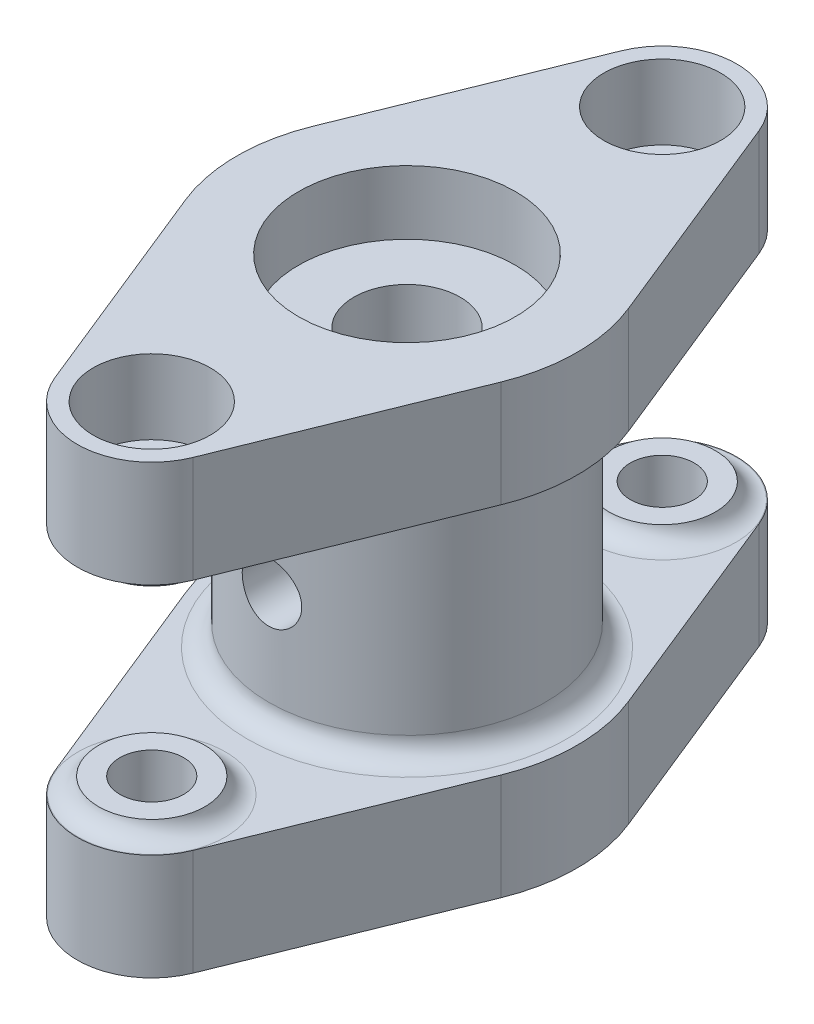
from build123d import *

# Parameters (mm, degrees)
SKETCH1_R           = 1.5
BOSS_EXTRUDE1_DEPTH = 5
SKETCH2_R           = 6.5
BOSS_EXTRUDE2_DEPTH = 11
SKETCH3_R           = 1.5
BOSS_EXTRUDE3_DEPTH = 5
SKETCH4_R           = 1.4
CUT_EXTRUDE1_DEPTH  = 28.299267389
FILLET1_R           = 1
CUT_EXTRUDE2_DEPTH  = 3
SKETCH8_R           = 2.5
SKETCH8_R_2         = 1.5
BOSS_EXTRUDE5_DEPTH = 0.75
FILLET4_R           = 1
BOSS_EXTRUDE6_START = 0.75
SKETCH9_R           = 2.5
SKETCH9_R_2         = 1.5
BOSS_EXTRUDE6_DEPTH = 0.75
FILLET5_R           = 1
SKETCH12_R          = 2.75
CUT_EXTRUDE5_DEPTH  = 3.5
SKETCH10_R          = 5.1
CUT_EXTRUDE3_DEPTH  = 3
CUT_EXTRUDE4_START  = -3.5
SKETCH11_R          = 5.1
CUT_EXTRUDE4_DEPTH  = 3.5


with BuildPart() as part:
    # Sketch1 → Boss-Extrude1 (new body)
    with BuildSketch(Plane(origin=(0, 0, 0), x_dir=(1, 0, 0), z_dir=(0, 1, 0))):
        with BuildLine():
            Line((-3.244586838, 13.3125), (-7.416198487, 3))
            ThreePointArc((-7.416198487, 3), (-8, 0), (-7.416198487, -3))
            Line((-7.416198487, -3), (-3.244586838, -13.3125))
            ThreePointArc((-3.244586838, -13.3125), (0, -15.5), (3.244586838, -13.3125))
            Line((3.244586838, -13.3125), (7.416198487, -3))
            ThreePointArc((7.416198487, -3), (8, 0), (7.416198487, 3))
            Line((7.416198487, 3), (3.244586838, 13.3125))
            ThreePointArc((3.244586838, 13.3125), (0, 15.5), (-3.244586838, 13.3125))
        make_face()
        with Locations(Location((0, 12, 0), (0, 0, 270))):
            Circle(SKETCH1_R, mode=Mode.SUBTRACT)
        with Locations(Location((0, -12, 0), (0, 0, 270))):
            Circle(SKETCH1_R, mode=Mode.SUBTRACT)
        with BuildLine():
            Line((-1.430908802, -2.05), (1.430908802, -2.05))
            ThreePointArc((1.430908802, -2.05), (0, 2.5), (-1.430908802, -2.05))
        make_face(mode=Mode.SUBTRACT)
    extrude(amount=BOSS_EXTRUDE1_DEPTH)

    # Sketch2 → Boss-Extrude2 (add)
    with BuildSketch(Plane(origin=(0, 5, 0), x_dir=(1, 0, 0), z_dir=(0, 1, 0))):
        with Locations(Location((0, 0, 0), (0, 0, 270))):
            Circle(SKETCH2_R)
        with BuildLine():
            Line((-1.430908802, -2.05), (1.430908802, -2.05))
            ThreePointArc((1.430908802, -2.05), (0, 2.5), (-1.430908802, -2.05))
        make_face(mode=Mode.SUBTRACT)
    extrude(amount=BOSS_EXTRUDE2_DEPTH)

    # Sketch3 → Boss-Extrude3 (add)
    with BuildSketch(Plane(origin=(0, 16, 0), x_dir=(1, 0, 0), z_dir=(0, 1, 0))):
        with BuildLine():
            Line((-3.244586838, 13.3125), (-7.416198487, 3))
            ThreePointArc((-7.416198487, 3), (-8, 0), (-7.416198487, -3))
            Line((-7.416198487, -3), (-3.244586838, -13.3125))
            ThreePointArc((-3.244586838, -13.3125), (0, -15.5), (3.244586838, -13.3125))
            Line((3.244586838, -13.3125), (7.416198487, -3))
            ThreePointArc((7.416198487, -3), (8, 0), (7.416198487, 3))
            Line((7.416198487, 3), (3.244586838, 13.3125))
            ThreePointArc((3.244586838, 13.3125), (0, 15.5), (-3.244586838, 13.3125))
        make_face()
        with Locations(Location((0, -12, 0), (0, 0, 270))):
            Circle(SKETCH3_R, mode=Mode.SUBTRACT)
        with Locations(Location((0, 12, 0), (0, 0, 270))):
            Circle(SKETCH3_R, mode=Mode.SUBTRACT)
        with BuildLine():
            Line((-1.430908802, -2.05), (1.430908802, -2.05))
            ThreePointArc((1.430908802, -2.05), (0, 2.5), (-1.430908802, -2.05))
        make_face(mode=Mode.SUBTRACT)
    extrude(amount=BOSS_EXTRUDE3_DEPTH)

    # Sketch4 → Cut-Extrude1 (cut, through all)
    with BuildSketch(Plane.XY):
        with Locations(Location((0, 10.5, 0), (0, 0, 180))):
            Circle(SKETCH4_R)
    extrude(amount=CUT_EXTRUDE1_DEPTH, mode=Mode.SUBTRACT)

    # Fillet1
    fillet1_edges = [part.edges().sort_by_distance(p)[0] for p in [
        (0, 16, -6.5),
        (0, 5, -6.5),
    ]]
    fillet(fillet1_edges, radius=FILLET1_R)

    # Sketch6 → Cut-Extrude2 (cut)
    with BuildSketch(Plane.XZ):
        Polygon((2.75, -13.58771324), (2.75, -10.41228676), (0, -8.824573519), (-2.75, -10.41228676), (-2.75, -13.58771324), (0, -15.175426481), align=None)
        Polygon((0, 15.175426481), (2.75, 13.58771324), (2.75, 10.41228676), (0, 8.824573519), (-2.75, 10.41228676), (-2.75, 13.58771324), align=None)
    extrude(amount=-CUT_EXTRUDE2_DEPTH, mode=Mode.SUBTRACT)

    # Sketch8 → Boss-Extrude5 (add)
    # profile 1 of 2: a face of its own
    with BuildSketch(Plane(origin=(0, 5, 0), x_dir=(1, 0, 0), z_dir=(0, 1, 0))):
        with Locations(Location((0, -12, 0), (0, 0, 270))):
            Circle(SKETCH8_R)
        with Locations(Location((0, -12, 0), (0, 0, 270))):
            Circle(SKETCH8_R_2, mode=Mode.SUBTRACT)
    # profile 2 of 2: a face of its own
    with BuildSketch(Plane(origin=(0, 5, 0), x_dir=(1, 0, 0), z_dir=(0, 1, 0))):
        with Locations(Location((0, 12, 0), (0, 0, 270))):
            Circle(SKETCH8_R)
        with Locations(Location((0, 12, 0), (0, 0, 90))):
            Circle(SKETCH8_R_2, mode=Mode.SUBTRACT)
    extrude(amount=BOSS_EXTRUDE5_DEPTH)

    # Fillet4
    # the kernel refuses this fillet: 1 mm, written as the material it adds along each edge
    with BuildSketch(Plane(origin=(0, 5, 12), x_dir=(0, 0, 1), z_dir=(-1, 0, 0))) as fillet4_piece_1:
        with BuildLine():
            CenterArc((3.468245837, 1), FILLET4_R, 194.477512186, 75.522487814)
            Line((2.5, 0.75), (2.480635083, 0.745))
            ThreePointArc((2.480635083, 0.745), (2.48, 0.375), (2.48, 0))
            Line((2.48, 0), (2.5, -0.02))
            Line((2.5, -0.02), (3.468245837, -0.02))
            Line((3.468245837, -0.02), (3.468245837, 0))
        make_face()
    revolve(axis=Axis((0, 5, 12), (0, 1, 0)))
    with BuildSketch(Plane(origin=(0, 5, -12), x_dir=(0, 0, 1), z_dir=(-1, 0, 0))) as fillet4_piece_2:
        with BuildLine():
            CenterArc((3.468245837, 1), FILLET4_R, 194.477512186, 75.522487814)
            Line((2.5, 0.75), (2.480635083, 0.745))
            ThreePointArc((2.480635083, 0.745), (2.48, 0.375), (2.48, 0))
            Line((2.48, 0), (2.5, -0.02))
            Line((2.5, -0.02), (3.468245837, -0.02))
            Line((3.468245837, -0.02), (3.468245837, 0))
        make_face()
    revolve(axis=Axis((0, 5, -12), (0, 1, 0)))

    # Sketch9 → Boss-Extrude6 (add)
    # profile 1 of 2: a face of its own
    with BuildSketch(Plane.XZ.offset(-16).offset(BOSS_EXTRUDE6_START)):
        with Locations(Location((0, -12, 0), (0, 0, 90))):
            Circle(SKETCH9_R)
        with Locations(Location((0, -12, 0), (0, 0, 270))):
            Circle(SKETCH9_R_2, mode=Mode.SUBTRACT)
    # profile 2 of 2: a face of its own
    with BuildSketch(Plane.XZ.offset(-16).offset(BOSS_EXTRUDE6_START)):
        with Locations(Location((0, 12, 0), (0, 0, 90))):
            Circle(SKETCH9_R)
        with Locations(Location((0, 12, 0), (0, 0, 90))):
            Circle(SKETCH9_R_2, mode=Mode.SUBTRACT)
    extrude(amount=-BOSS_EXTRUDE6_DEPTH)

    # Fillet5
    # the kernel refuses this fillet: 1 mm, written as the material it adds along each edge
    with BuildSketch(Plane(origin=(0, 16, -12), x_dir=(0, 0, 1), z_dir=(1, 0, 0))) as fillet5_piece_1:
        with BuildLine():
            CenterArc((3.468245837, 1), FILLET5_R, 194.477512186, 75.522487814)
            Line((2.5, 0.75), (2.480635083, 0.745))
            ThreePointArc((2.480635083, 0.745), (2.48, 0.375), (2.48, 0))
            Line((2.48, 0), (2.5, -0.02))
            Line((2.5, -0.02), (3.468245837, -0.02))
            Line((3.468245837, -0.02), (3.468245837, 0))
        make_face()
    revolve(axis=Axis((0, 16, -12), (0, -1, 0)))
    with BuildSketch(Plane(origin=(0, 16, 12), x_dir=(0, 0, 1), z_dir=(1, 0, 0))) as fillet5_piece_2:
        with BuildLine():
            CenterArc((3.468245837, 1), FILLET5_R, 194.477512186, 75.522487814)
            Line((2.5, 0.75), (2.480635083, 0.745))
            ThreePointArc((2.480635083, 0.745), (2.48, 0.375), (2.48, 0))
            Line((2.48, 0), (2.5, -0.02))
            Line((2.5, -0.02), (3.468245837, -0.02))
            Line((3.468245837, -0.02), (3.468245837, 0))
        make_face()
    revolve(axis=Axis((0, 16, 12), (0, -1, 0)))

    # Sketch12 → Cut-Extrude5 (cut)
    with BuildSketch(Plane(origin=(0, 21, 0), x_dir=(1, 0, 0), z_dir=(0, 1, 0))):
        with Locations(Location((0, 12, 0), (0, 0, 270))):
            Circle(SKETCH12_R)
        with Locations(Location((0, -12, 0), (0, 0, 270))):
            Circle(SKETCH12_R)
    extrude(amount=-CUT_EXTRUDE5_DEPTH, mode=Mode.SUBTRACT)

    # Sketch10 → Cut-Extrude3 (cut)
    with BuildSketch(Plane(origin=(0, 21, 0), x_dir=(1, 0, 0), z_dir=(0, 1, 0))):
        with Locations(Location((0, 0, 0), (0, 0, 270))):
            Circle(SKETCH10_R)
    extrude(amount=-CUT_EXTRUDE3_DEPTH, mode=Mode.SUBTRACT)

    # Sketch11 → Cut-Extrude4 (cut)
    with BuildSketch(Plane.XZ.offset(CUT_EXTRUDE4_START)):
        with Locations(Location((0, 0, 0), (0, 0, 90))):
            Circle(SKETCH11_R)
    extrude(amount=CUT_EXTRUDE4_DEPTH, mode=Mode.SUBTRACT)


solid = part.part
